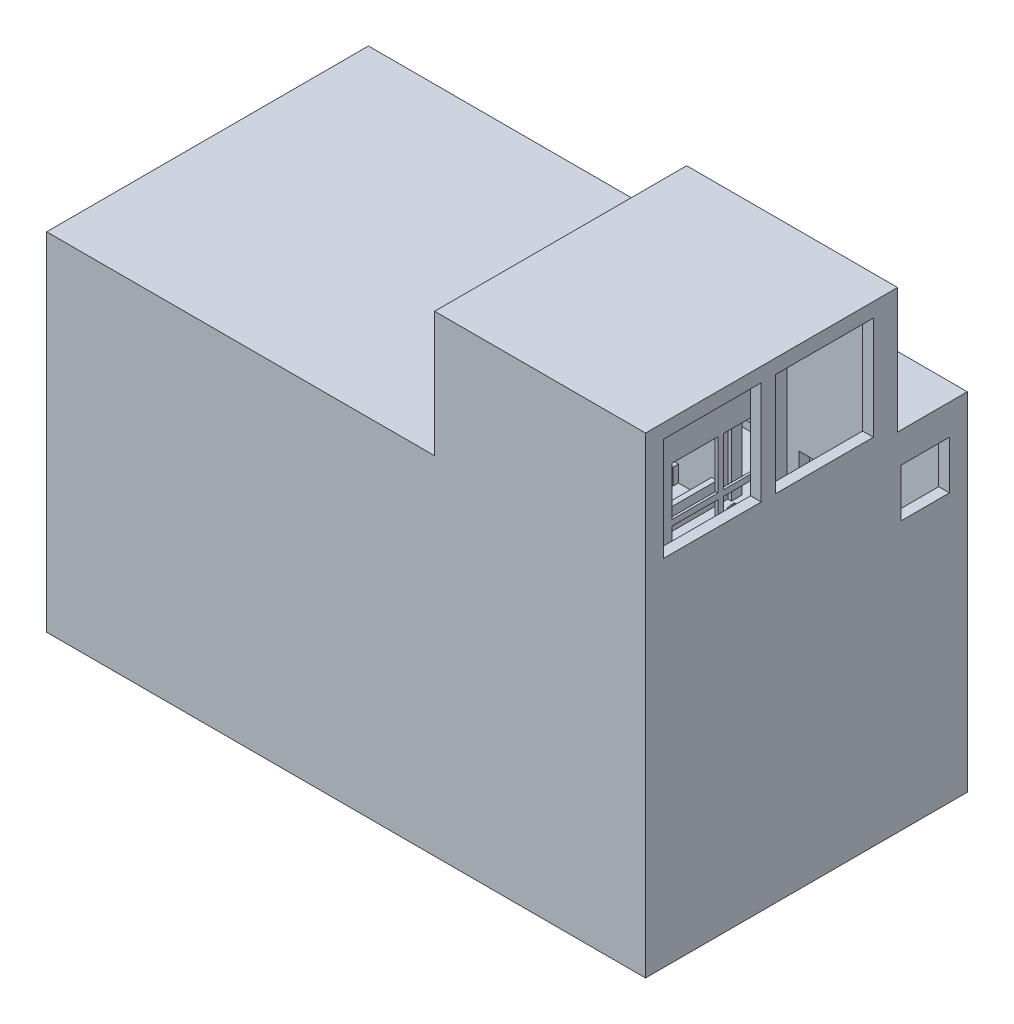
from build123d import *

# Parameters (mm, degrees)
SKETCH1_W                        = 16750
SKETCH1_H                        = 9000
BOSS_EXTRUDE1_DEPTH              = 1500
SKETCH2_W                        = 16750
SKETCH2_H                        = 9000
SKETCH2_W_2                      = 16150
SKETCH2_H_2                      = 8400
EXTRUDE_THIN1_DEPTH              = 6700
EXTRUDE_THIN2_DEPTH              = 2800
SKETCH4_W                        = 300
SKETCH4_H                        = 6450
EXTRUDE_THIN3_DEPTH              = 2800
EXTRUDE_THIN4_DEPTH              = 2800
SKETCH6_W                        = 1900
SKETCH6_H                        = 1900
CUT_EXTRUDE1_DEPTH               = 300
SKETCH7_W                        = 2584
SKETCH7_H                        = 2584
CUT_EXTRUDE2_DEPTH               = 300
CUT_EXTRUDE3_DEPTH               = 1800
CUT_EXTRUDE3_DEPTH_BACK          = 300
SKETCH8_W                        = 960
SKETCH8_H                        = 1899.50292133
SKETCH8_H_2                      = 2160
CUT_EXTRUDE4_DEPTH               = 50
SKETCH10_W                       = 4700
SKETCH10_H                       = 4700
CUT_EXTRUDE5_DEPTH               = 11632.019946677
SKETCH11_W                       = 960
SKETCH11_H                       = 2160
CUT_EXTRUDE6_DEPTH               = 14597.938891425
SKETCH12_W                       = 8400
SKETCH12_H                       = 200
BOSS_EXTRUDE2_DEPTH              = 16150
SKETCH13_W                       = 5600
SKETCH13_H                       = 300
EXTRUDE_THIN5_DEPTH              = 3500
SKETCH14_W                       = 300
SKETCH14_H                       = 6450
EXTRUDE_THIN6_DEPTH              = 3500
SKETCH15_W                       = 150
SKETCH15_H                       = 6150
EXTRUDE_THIN7_DEPTH              = 600
SKETCH16_W                       = 4500
SKETCH16_H                       = 300
EXTRUDE_THIN8_DEPTH              = 3500
SKETCH17_W                       = 7500
SKETCH17_H                       = 300
EXTRUDE_THIN9_DEPTH              = 3500
SKETCH18_W                       = 300
SKETCH18_H                       = 6150
EXTRUDE_THIN10_DEPTH             = 3500
SKETCH19_W                       = 1900
SKETCH19_H                       = 1900
CUT_EXTRUDE7_DEPTH               = 600
SKETCH22_W                       = 2736
SKETCH22_H                       = 2888
CUT_EXTRUDE8_DEPTH               = 800
SKETCH23_W                       = 2500
SKETCH23_H                       = 6450
CUT_EXTRUDE9_DEPTH               = 800
SKETCH25_W                       = 960
SKETCH25_H                       = 2160
CUT_EXTRUDE11_DEPTH              = 800
SKETCH26_W                       = 960
SKETCH26_H                       = 2160
CUT_EXTRUDE12_DEPTH              = 800
CUT_EXTRUDE13_DEPTH              = 50
BOSS_EXTRUDE7_REACH              = 11244.359
SKETCH34_W                       = 1350
SKETCH34_H                       = 150
SKETCH35_W                       = 150
SKETCH35_H                       = 700
CUT_EXTRUDE16_DEPTH              = 600
SKETCH36_W                       = 400
SKETCH36_H                       = 6150
BOSS_EXTRUDE8_DEPTH              = 460
SKETCH37_W                       = 400
SKETCH37_H                       = 255
SKETCH37_H_2                     = 706.5
CUT_EXTRUDE17_DEPTH              = 460
SKETCH38_W                       = 400
SKETCH38_H                       = 707
CUT_EXTRUDE18_DEPTH              = 460
SKETCH39_W                       = 250
SKETCH39_H                       = 6150
BOSS_EXTRUDE9_DEPTH              = 460
SKETCH40_W                       = 250
SKETCH40_H                       = 600
CUT_EXTRUDE19_DEPTH              = 460
SKETCH41_W                       = 600
SKETCH41_H                       = 150
BOSS_EXTRUDE10_DEPTH             = 400
SKETCH51_W                       = 5800
SKETCH51_H                       = 4300
CUT_EXTRUDE22_DEPTH              = 300
SKETCH52_W                       = 1350
SKETCH52_H                       = 1350
CUT_EXTRUDE23_DEPTH              = 300
SKETCH53_W                       = 1350
SKETCH53_H                       = 1350
CUT_EXTRUDE24_DEPTH              = 300
SKETCH54_W                       = 1350
SKETCH54_H                       = 1350
CUT_EXTRUDE26_DEPTH              = 300
SKETCH56_R                       = 84
CUT_EXTRUDE27_DEPTH              = 300
SKETCH28_W                       = 6750
SKETCH28_H                       = 200
BOSS_EXTRUDE11_DEPTH             = 16150
SKETCH58_W                       = 5900
SKETCH58_H                       = 7050
SKETCH58_W_2                     = 5300
SKETCH58_H_2                     = 6450
EXTRUDE_THIN11_DEPTH             = 3300
SKETCH44_W                       = 2736
SKETCH44_H                       = 2888
CUT_EXTRUDE28_DEPTH              = 6000
SKETCH59_W                       = 2500
SKETCH59_H                       = 6450
CUT_EXTRUDE29_DEPTH              = 300
SKETCH60_W                       = 300
SKETCH60_H                       = 6450
BOSS_EXTRUDE12_DEPTH             = 3300
SKETCH61_W                       = 7050
SKETCH61_H                       = 200
BOSS_EXTRUDE13_DEPTH             = 5900
SKETCH62_W                       = 1650
SKETCH62_H                       = 200
BOSS_EXTRUDE14_DEPTH             = 16150
SKETCH63_W                       = 300
SKETCH63_H                       = 2736
BOSS_EXTRUDE15_DEPTH             = 332
EXTRUDE_THIN12_REACH             = 15393.099
EXTRUDE_THIN12_DIRECTION_2_REACH = 15393.099
EXTRUDE_THIN13_DEPTH             = 2736
EXTRUDE_THIN14_DEPTH             = 2888


with BuildPart() as part:
    # Sketch1 → Boss-Extrude1 (new, symmetric)
    with BuildSketch(Plane(origin=(0, 0, 0), x_dir=(1, 0, 0), z_dir=(0, 1, 0))):
        Rectangle(SKETCH1_W, SKETCH1_H)
    extrude(amount=BOSS_EXTRUDE1_DEPTH, both=True)

    # Sketch2 → Extrude-Thin1 (add)
    with BuildSketch(Plane(origin=(0, 1500, 0), x_dir=(1, 0, 0), z_dir=(0, 1, 0))):
        Rectangle(SKETCH2_W, SKETCH2_H)
        Rectangle(SKETCH2_W_2, SKETCH2_H_2, mode=Mode.SUBTRACT)
    extrude(amount=EXTRUDE_THIN1_DEPTH)

    # Sketch3 → Extrude-Thin2 (add)
    with BuildSketch(Plane(origin=(0, 1500, 0), x_dir=(1, 0, 0), z_dir=(0, 1, 0))):
        Polygon((8075, 2550), (-2825, 2550), (-2825, -4200), (-2525, -4200), (-2525, 2250), (8075, 2250), align=None)
    extrude(amount=EXTRUDE_THIN2_DEPTH)

    # Sketch4 → Extrude-Thin3 (add)
    with BuildSketch(Plane(origin=(0, 1500, 0), x_dir=(1, 0, 0), z_dir=(0, 1, 0))):
        with Locations((5425, -975)):
            Rectangle(SKETCH4_W, SKETCH4_H)
        with Locations((3925, -975)):
            Rectangle(SKETCH4_W, SKETCH4_H)
    extrude(amount=EXTRUDE_THIN3_DEPTH)

    # Sketch5 → Extrude-Thin4 (add)
    with BuildSketch(Plane(origin=(0, 1500, 0), x_dir=(1, 0, 0), z_dir=(0, 1, 0))):
        Polygon((-5325, -4200), (-5325, 750), (-2825, 750), (-2825, 1050), (-5625, 1050), (-5625, -4200), align=None)
    extrude(amount=EXTRUDE_THIN4_DEPTH)

    # Sketch6 → Cut-Extrude1 (cut)
    with BuildSketch(Plane.ZY.offset(-5275)):
        with Locations((2600, 2792)):
            Rectangle(SKETCH6_W, SKETCH6_H)
        with Locations((-550, 2792)):
            Rectangle(SKETCH6_W, SKETCH6_H)
    extrude(amount=-CUT_EXTRUDE1_DEPTH, mode=Mode.SUBTRACT)

    # Sketch7 → Cut-Extrude2 (cut)
    with BuildSketch(Plane.ZY.offset(-3775)):
        with Locations((2678, 2792)):
            Rectangle(SKETCH7_W, SKETCH7_H)
        with Locations((-472, 2792)):
            Rectangle(SKETCH7_W, SKETCH7_H)
    extrude(amount=-CUT_EXTRUDE2_DEPTH, mode=Mode.SUBTRACT)

    # Sketch8 → Cut-Extrude3 (cut, two sides: drawn at the far end of the back side and taken through both)
    with BuildSketch(Plane.XY.offset(-2250).offset(-CUT_EXTRUDE3_DEPTH_BACK)):
        with Locations((7495, 2449.751460665)):
            Rectangle(SKETCH8_W, SKETCH8_H)
        with Locations((4655, 2580)):
            Rectangle(SKETCH8_W, SKETCH8_H_2)
        with Locations((-1945, 2580)):
            Rectangle(SKETCH8_W, SKETCH8_H_2)
        with Locations((-4745, 2580)):
            Rectangle(SKETCH8_W, SKETCH8_H_2)
    extrude(amount=CUT_EXTRUDE3_DEPTH + CUT_EXTRUDE3_DEPTH_BACK, mode=Mode.SUBTRACT)

    # Sketch9 → Cut-Extrude4 (cut)
    with BuildSketch(Plane(origin=(0, 1500, 0), x_dir=(1, 0, 0), z_dir=(0, 1, 0))):
        with BuildLine():
            Line((-2345, 2550), (-1545, 2550))
            Line((-1545, 2550), (-1545, 3350))
            ThreePointArc((-1545, 3350), (-2110.685424949, 3115.685424949), (-2345, 2550))
        make_face()
        with BuildLine():
            Line((4255, 2550), (5055, 2550))
            Line((5055, 2550), (5055, 3350))
            ThreePointArc((5055, 3350), (4489.314575051, 3115.685424949), (4255, 2550))
        make_face()
        with BuildLine():
            Line((7895, 2250), (7095, 2250))
            Line((7095, 2250), (7095, 1450))
            ThreePointArc((7095, 1450), (7660.685424949, 1684.314575051), (7895, 2250))
        make_face()
        with BuildLine():
            Line((-4345, 750), (-5145, 750))
            Line((-5145, 750), (-5145, -50))
            ThreePointArc((-5145, -50), (-4579.314575051, 184.314575051), (-4345, 750))
        make_face()
    extrude(amount=-CUT_EXTRUDE4_DEPTH, mode=Mode.SUBTRACT)

    # Sketch10 → Cut-Extrude5 (cut, through all)
    with BuildSketch(Plane(origin=(0, 1500, 0), x_dir=(1, 0, 0), z_dir=(0, 1, 0))):
        with Locations((1125, -1000)):
            Rectangle(SKETCH10_W, SKETCH10_H)
    extrude(amount=-CUT_EXTRUDE5_DEPTH, mode=Mode.SUBTRACT)

    # Sketch11 → Cut-Extrude6 (cut, through all)
    with BuildSketch(Plane.XY.offset(-4200)):
        with Locations((-7095, 2580)):
            Rectangle(SKETCH11_W, SKETCH11_H)
    extrude(amount=-CUT_EXTRUDE6_DEPTH, mode=Mode.SUBTRACT)

    # Sketch12 → Boss-Extrude2 (add)
    with BuildSketch(Plane.ZY.offset(-8075)):
        with Locations((0, 4400)):
            Rectangle(SKETCH12_W, SKETCH12_H)
    extrude(amount=BOSS_EXTRUDE2_DEPTH)

    # Sketch13 → Extrude-Thin5 (add)
    with BuildSketch(Plane(origin=(0, 4500, 0), x_dir=(1, 0, 0), z_dir=(0, 1, 0))):
        with Locations((5275, 2400)):
            Rectangle(SKETCH13_W, SKETCH13_H)
    extrude(amount=EXTRUDE_THIN5_DEPTH)

    # Sketch14 → Extrude-Thin6 (add)
    with BuildSketch(Plane(origin=(0, 4500, 0), x_dir=(1, 0, 0), z_dir=(0, 1, 0))):
        with Locations((5425, -975)):
            Rectangle(SKETCH14_W, SKETCH14_H)
    extrude(amount=EXTRUDE_THIN6_DEPTH)

    # Sketch15 → Extrude-Thin7 (add)
    with BuildSketch(Plane(origin=(0, 4500, 0), x_dir=(1, 0, 0), z_dir=(0, 1, 0))):
        with Locations((3850, -1125)):
            Rectangle(SKETCH15_W, SKETCH15_H)
        with Locations((-500, -1125)):
            Rectangle(SKETCH15_W, SKETCH15_H)
    extrude(amount=EXTRUDE_THIN7_DEPTH)

    # Sketch16 → Extrude-Thin8 (add)
    with BuildSketch(Plane(origin=(0, 4500, 0), x_dir=(1, 0, 0), z_dir=(0, 1, 0))):
        with Locations((1675, 2100)):
            Rectangle(SKETCH16_W, SKETCH16_H)
    extrude(amount=EXTRUDE_THIN8_DEPTH)

    # Sketch17 → Extrude-Thin9 (add)
    with BuildSketch(Plane(origin=(0, 4500, 0), x_dir=(1, 0, 0), z_dir=(0, 1, 0))):
        with Locations((-4325, 2100)):
            Rectangle(SKETCH17_W, SKETCH17_H)
    extrude(amount=EXTRUDE_THIN9_DEPTH)

    # Sketch18 → Extrude-Thin10 (add)
    with BuildSketch(Plane(origin=(0, 4500, 0), x_dir=(1, 0, 0), z_dir=(0, 1, 0))):
        with Locations((-6525, -1125)):
            Rectangle(SKETCH18_W, SKETCH18_H)
    extrude(amount=EXTRUDE_THIN10_DEPTH)

    # Sketch19 → Cut-Extrude7 (cut)
    with BuildSketch(Plane.XY.offset(-1950)):
        with Locations((-2575, 7450)):
            Rectangle(SKETCH19_W, SKETCH19_H)
        with Locations((-5075, 7450)):
            Rectangle(SKETCH19_W, SKETCH19_H)
    extrude(amount=-CUT_EXTRUDE7_DEPTH, mode=Mode.SUBTRACT)

    # Sketch22 → Cut-Extrude8 (cut)
    with BuildSketch(Plane.ZY.offset(-5275)):
        with Locations((2632, 6356)):
            Rectangle(SKETCH22_W, SKETCH22_H)
        with Locations((-404, 6356)):
            Rectangle(SKETCH22_W, SKETCH22_H)
    extrude(amount=-CUT_EXTRUDE8_DEPTH, mode=Mode.SUBTRACT)

    # Sketch23 → Cut-Extrude9 (cut)
    with BuildSketch(Plane(origin=(0, 4500, 0), x_dir=(1, 0, 0), z_dir=(0, 1, 0))):
        with Locations((6825, -975)):
            Rectangle(SKETCH23_W, SKETCH23_H)
    extrude(amount=-CUT_EXTRUDE9_DEPTH, mode=Mode.SUBTRACT)

    # Sketch25 → Cut-Extrude11 (cut)
    with BuildSketch(Plane.XY.offset(-1950)):
        with Locations((-7595, 5580)):
            Rectangle(SKETCH25_W, SKETCH25_H)
        with Locations((4505, 5580)):
            Rectangle(SKETCH25_W, SKETCH25_H)
        with Locations((-1055, 5580)):
            Rectangle(SKETCH25_W, SKETCH25_H)
    extrude(amount=-CUT_EXTRUDE11_DEPTH, mode=Mode.SUBTRACT)

    # Sketch26 → Cut-Extrude12 (cut)
    with BuildSketch(Plane.XY.offset(-2250)):
        with Locations((6395, 5580)):
            Rectangle(SKETCH26_W, SKETCH26_H)
    extrude(amount=-CUT_EXTRUDE12_DEPTH, mode=Mode.SUBTRACT)

    # Sketch27 → Cut-Extrude13 (cut)
    with BuildSketch(Plane(origin=(0, 4500, 0), x_dir=(1, 0, 0), z_dir=(0, 1, 0))):
        with BuildLine():
            Line((4905, 2250), (4105, 2250))
            ThreePointArc((4105, 2250), (4339.314575051, 1684.314575051), (4905, 1450))
            Line((4905, 1450), (4905, 2250))
        make_face()
        with BuildLine():
            Line((-7195, 1950), (-7995, 1950))
            ThreePointArc((-7995, 1950), (-7760.685424949, 1384.314575051), (-7195, 1150))
            Line((-7195, 1150), (-7195, 1950))
        make_face()
    extrude(amount=-CUT_EXTRUDE13_DEPTH, mode=Mode.SUBTRACT)

    # Boss-Extrude7: up to this face of the body (flat: up to its plane)
    boss_extrude7_end = Plane(part.part.faces().sort_by_distance((3850, 5100, 1125))[0])
    # Sketch34 → Boss-Extrude7 (add, up to the picked face)
    with BuildSketch(Plane(origin=(0, 4500, 0), x_dir=(1, 0, 0), z_dir=(0, 1, 0)), mode=Mode.PRIVATE) as boss_extrude7_sk1:
        with Locations((4600, -2625)):
            Rectangle(SKETCH34_W, SKETCH34_H)
    boss_extrude7_tool1 = split(extrude(boss_extrude7_sk1.sketch, amount=BOSS_EXTRUDE7_REACH, mode=Mode.PRIVATE), bisect_by=boss_extrude7_end, keep=Keep.BOTH, mode=Mode.PRIVATE)
    add(boss_extrude7_tool1.solids().sort_by(Axis((4600, 4500, 2625), (0, 1, 0)))[0])

    # Sketch35 → Cut-Extrude16 (cut)
    with BuildSketch(Plane(origin=(0, 5100, 0), x_dir=(1, 0, 0), z_dir=(0, 1, 0))):
        with Locations((3850, -3850)):
            Rectangle(SKETCH35_W, SKETCH35_H)
    extrude(amount=-CUT_EXTRUDE16_DEPTH, mode=Mode.SUBTRACT)

    # Sketch36 → Boss-Extrude8 (add)
    with BuildSketch(Plane(origin=(0, 4500, 0), x_dir=(1, 0, 0), z_dir=(0, 1, 0))):
        with Locations((-75, -1125)):
            Rectangle(SKETCH36_W, SKETCH36_H)
    extrude(amount=BOSS_EXTRUDE8_DEPTH)

    # Sketch37 → Cut-Extrude17 (cut)
    with BuildSketch(Plane(origin=(0, 4960, 0), x_dir=(1, 0, 0), z_dir=(0, 1, 0))):
        with Locations((-75, 1822.5)):
            Rectangle(SKETCH37_W, SKETCH37_H)
        with Locations((-75, 1141.75)):
            Rectangle(SKETCH37_W, SKETCH37_H_2)
        with Locations((-75, 235.25)):
            Rectangle(SKETCH37_W, SKETCH37_H_2)
    cut_extrude17 = extrude(amount=-CUT_EXTRUDE17_DEPTH, mode=Mode.SUBTRACT)

    # Mirror1: Cut-Extrude17 across plane
    add(cut_extrude17.mirror(Plane.XY.offset(1125)), mode=Mode.SUBTRACT)

    # Sketch38 → Cut-Extrude18 (cut)
    with BuildSketch(Plane(origin=(0, 4960, 0), x_dir=(1, 0, 0), z_dir=(0, 1, 0))):
        with Locations((-75, -671.5)):
            Rectangle(SKETCH38_W, SKETCH38_H)
        with Locations((-75, -1578.5)):
            Rectangle(SKETCH38_W, SKETCH38_H)
    extrude(amount=-CUT_EXTRUDE18_DEPTH, mode=Mode.SUBTRACT)

    # Sketch39 → Boss-Extrude9 (add)
    with BuildSketch(Plane(origin=(0, 4500, 0), x_dir=(1, 0, 0), z_dir=(0, 1, 0))):
        with Locations((2720, -1125)):
            Rectangle(SKETCH39_W, SKETCH39_H)
    extrude(amount=BOSS_EXTRUDE9_DEPTH)

    # Sketch40 → Cut-Extrude19 (cut)
    with BuildSketch(Plane(origin=(0, 4960, 0), x_dir=(1, 0, 0), z_dir=(0, 1, 0))):
        with Locations((2720, 1500)):
            Rectangle(SKETCH40_W, SKETCH40_H)
        with Locations((2720, 600)):
            Rectangle(SKETCH40_W, SKETCH40_H)
        with Locations((2720, -300)):
            Rectangle(SKETCH40_W, SKETCH40_H)
        with Locations((2720, -1200)):
            Rectangle(SKETCH40_W, SKETCH40_H)
        with Locations((2720, -2100)):
            Rectangle(SKETCH40_W, SKETCH40_H)
        with Locations((2720, -3000)):
            Rectangle(SKETCH40_W, SKETCH40_H)
        with Locations((2720, -3900)):
            Rectangle(SKETCH40_W, SKETCH40_H)
    extrude(amount=-CUT_EXTRUDE19_DEPTH, mode=Mode.SUBTRACT)

    # Sketch41 → Boss-Extrude10 (add)
    with BuildSketch(Plane(origin=(0, 4500, 0), x_dir=(1, 0, 0), z_dir=(0, 1, 0))):
        with Locations((2095, 1445)):
            Rectangle(SKETCH41_W, SKETCH41_H)
        with Locations((2095, -225)):
            Rectangle(SKETCH41_W, SKETCH41_H)
    boss_extrude10 = extrude(amount=BOSS_EXTRUDE10_DEPTH)

    # Mirror2: Boss-Extrude10 across plane
    add(boss_extrude10.mirror(Plane.XY.offset(1125)))

    # Sketch51 → Cut-Extrude22 (cut)
    with BuildSketch(Plane(origin=(0, 0, -2250), x_dir=(-1, 0, 0), z_dir=(0, 0, -1))):
        with Locations((3475, 6650)):
            Rectangle(SKETCH51_W, SKETCH51_H)
    extrude(amount=-CUT_EXTRUDE22_DEPTH, mode=Mode.SUBTRACT)

    # Sketch52 → Cut-Extrude23 (cut)
    with BuildSketch(Plane(origin=(-8075, 0, 0), x_dir=(0, 0, -1), z_dir=(1, 0, 0))):
        with Locations((3175, 6675)):
            Rectangle(SKETCH52_W, SKETCH52_H)
    extrude(amount=-CUT_EXTRUDE23_DEPTH, mode=Mode.SUBTRACT)

    # Sketch53 → Cut-Extrude24 (cut)
    with BuildSketch(Plane.ZY.offset(-8075)):
        with Locations((-3325, 6675)):
            Rectangle(SKETCH53_W, SKETCH53_H)
    extrude(amount=-CUT_EXTRUDE24_DEPTH, mode=Mode.SUBTRACT)

    # Sketch54 → Cut-Extrude26 (cut)
    with BuildSketch(Plane.XY.offset(-4200)):
        with Locations((-6625, 6675)):
            Rectangle(SKETCH54_W, SKETCH54_H)
        with Locations((-625, 6675)):
            Rectangle(SKETCH54_W, SKETCH54_H)
        with Locations((5400, 6675)):
            Rectangle(SKETCH54_W, SKETCH54_H)
    extrude(amount=-CUT_EXTRUDE26_DEPTH, mode=Mode.SUBTRACT)

    # Sketch56 → Cut-Extrude27 (cut)
    with BuildSketch(Plane.XY.offset(2700)):
        with Locations((4525, 4845)):
            Circle(SKETCH56_R)
    extrude(amount=-CUT_EXTRUDE27_DEPTH, mode=Mode.SUBTRACT)

    # Sketch28 → Boss-Extrude11 (add)
    with BuildSketch(Plane.ZY.offset(-8075)):
        with Locations((825, 8100)):
            Rectangle(SKETCH28_W, SKETCH28_H)
    extrude(amount=BOSS_EXTRUDE11_DEPTH)

    # Sketch58 → Extrude-Thin11 (add)
    with BuildSketch(Plane(origin=(0, 8200, 0), x_dir=(1, 0, 0), z_dir=(0, 1, 0))):
        with Locations((5425, -975)):
            Rectangle(SKETCH58_W, SKETCH58_H)
        with Locations((5425, -975)):
            Rectangle(SKETCH58_W_2, SKETCH58_H_2, mode=Mode.SUBTRACT)
    extrude(amount=EXTRUDE_THIN11_DEPTH)

    # Sketch44 → Cut-Extrude28 (cut)
    with BuildSketch(Plane(origin=(8375, 0, 0), x_dir=(0, 0, -1), z_dir=(1, 0, 0))):
        with Locations((-2632, 9856)):
            Rectangle(SKETCH44_W, SKETCH44_H)
        with Locations((504, 9856)):
            Rectangle(SKETCH44_W, SKETCH44_H)
    extrude(amount=-CUT_EXTRUDE28_DEPTH, mode=Mode.SUBTRACT)

    # Sketch59 → Cut-Extrude29 (cut)
    with BuildSketch(Plane(origin=(0, 8200, 0), x_dir=(1, 0, 0), z_dir=(0, 1, 0))):
        with Locations((6825, -975)):
            Rectangle(SKETCH59_W, SKETCH59_H)
        with Locations((4025, -975)):
            Rectangle(SKETCH59_W, SKETCH59_H)
    extrude(amount=-CUT_EXTRUDE29_DEPTH, mode=Mode.SUBTRACT)

    # Sketch60 → Boss-Extrude12 (add)
    with BuildSketch(Plane(origin=(0, 8200, 0), x_dir=(1, 0, 0), z_dir=(0, 1, 0))):
        with Locations((5425, -975)):
            Rectangle(SKETCH60_W, SKETCH60_H)
    extrude(amount=BOSS_EXTRUDE12_DEPTH)

    # Sketch61 → Boss-Extrude13 (add)
    with BuildSketch(Plane.ZY.offset(-2475)):
        with Locations((975, 11600)):
            Rectangle(SKETCH61_W, SKETCH61_H)
    extrude(amount=-BOSS_EXTRUDE13_DEPTH)

    # Sketch62 → Boss-Extrude14 (add)
    with BuildSketch(Plane(origin=(-8075, 0, 0), x_dir=(0, 0, -1), z_dir=(1, 0, 0))):
        with Locations((3375, 8100)):
            Rectangle(SKETCH62_W, SKETCH62_H)
    extrude(amount=BOSS_EXTRUDE14_DEPTH)

    # Sketch63 → Boss-Extrude15 (add)
    with BuildSketch(Plane(origin=(0, 4912, 0), x_dir=(1, 0, 0), z_dir=(0, 1, 0))):
        with Locations((5425, -2632)):
            Rectangle(SKETCH63_W, SKETCH63_H)
    extrude(amount=BOSS_EXTRUDE15_DEPTH)

    # Extrude-Thin12: up to this face of the body (flat: up to its plane)
    extrude_thin12_end = Plane(part.part.faces().sort_by_distance((5425, 6356, -1772))[0])
    # Sketch64 → Extrude-Thin12 (add, up to the picked face)
    with BuildSketch(Plane(origin=(0, 0, 964), x_dir=(-1, 0, 0), z_dir=(0, 0, -1)), mode=Mode.PRIVATE) as extrude_thin12_sk1:
        Polygon((-5510, 6436), (-5575, 6436), (-5575, 6276), (-5510, 6276), (-5510, 6286), (-5565, 6286), (-5565, 6426), (-5510, 6426), align=None)
    extrude_thin12_tool1 = split(extrude(extrude_thin12_sk1.sketch, amount=EXTRUDE_THIN12_REACH, mode=Mode.PRIVATE), bisect_by=extrude_thin12_end, keep=Keep.BOTH, mode=Mode.PRIVATE)
    add(extrude_thin12_tool1.solids().sort_by(Axis((5542.5, 6434.273008, 964), (0, 0, -1)))[0])

    # Extrude-Thin12 direction 2: up to this face of the body (flat: up to its plane)
    extrude_thin12_direction_2_end = Plane(part.part.faces().sort_by_distance((5425, 6522, 4000))[0])
    # Sketch64 → Extrude-Thin12 direction 2 (add, up to the picked face)
    with BuildSketch(Plane(origin=(0, 0, 964), x_dir=(-1, 0, 0), z_dir=(0, 0, -1)), mode=Mode.PRIVATE) as extrude_thin12_direction_2_sk1:
        Polygon((-5510, 6436), (-5575, 6436), (-5575, 6276), (-5510, 6276), (-5510, 6286), (-5565, 6286), (-5565, 6426), (-5510, 6426), align=None)
    extrude_thin12_direction_2_tool1 = split(extrude(extrude_thin12_direction_2_sk1.sketch, amount=-EXTRUDE_THIN12_DIRECTION_2_REACH, mode=Mode.PRIVATE), bisect_by=extrude_thin12_direction_2_end, keep=Keep.BOTH, mode=Mode.PRIVATE)
    add(extrude_thin12_direction_2_tool1.solids().sort_by(Axis((5542.5, 6434.273008, 964), (0, 0, 1)))[0])

    # Sketch66 → Extrude-Thin13 (add)
    with BuildSketch(Plane(origin=(0, 5244, 0), x_dir=(1, 0, 0), z_dir=(0, 1, 0))):
        Polygon((5499, -2552), (5575, -2552), (5575, -2712), (5499, -2712), (5499, -2702), (5565, -2702), (5565, -2562), (5499, -2562), align=None)
    extrude(amount=EXTRUDE_THIN13_DEPTH)

    # Sketch65 → Extrude-Thin14 (add)
    with BuildSketch(Plane(origin=(0, 4912, 0), x_dir=(1, 0, 0), z_dir=(0, 1, 0))):
        Polygon((5499, 484), (5575, 484), (5575, 324), (5499, 324), (5499, 334), (5565, 334), (5565, 474), (5499, 474), align=None)
    extrude(amount=EXTRUDE_THIN14_DEPTH)


solid = part.part
